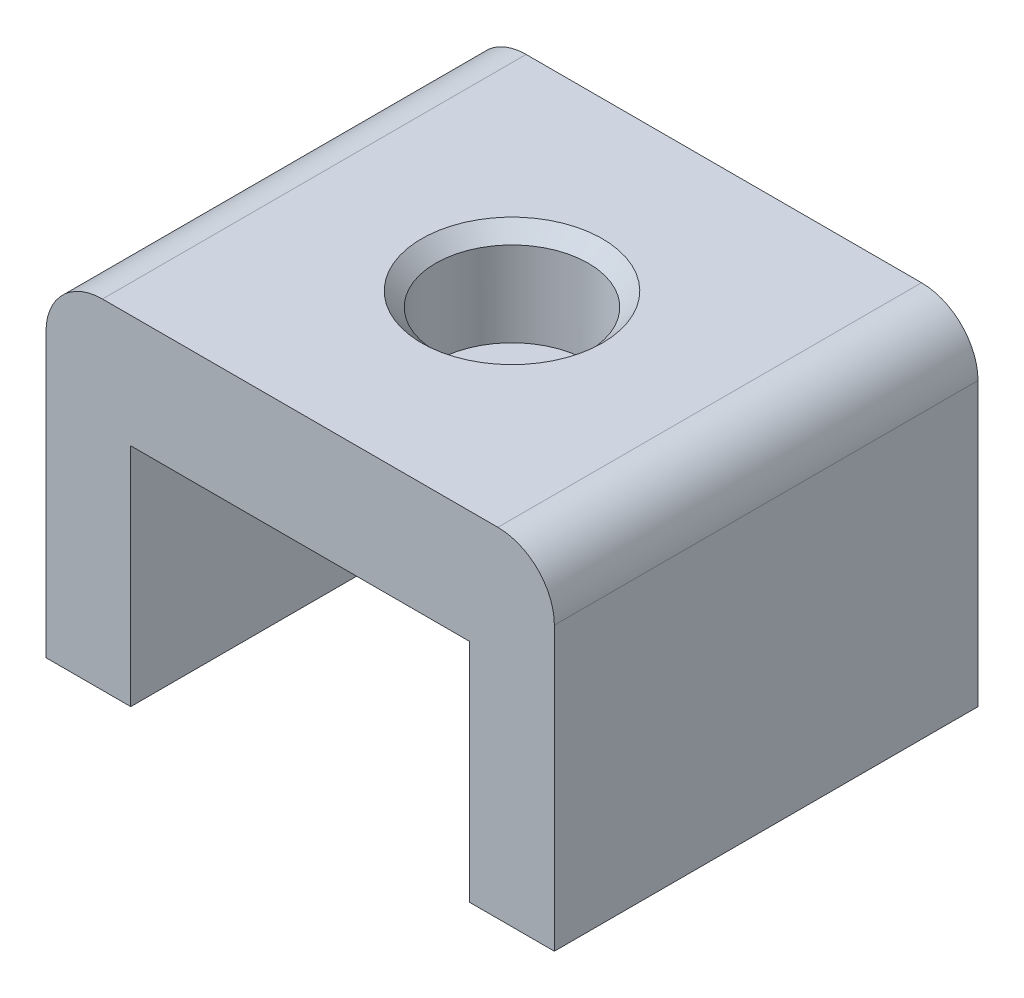
from build123d import *

# Parameters (mm, degrees)
EXTRUDE_1_DEPTH     = 15
SKETCH_2_R          = 2.7
CUT_EXTRUDE_1_DEPTH = 3.5
SKETCH_3_R          = 1.65
CUT_EXTRUDE_2_DEPTH = 25.924887161
FILLET_1_R          = 2
CHAMFER_1_SIZE      = 0.5


# Read off the part's stored shape, not the designer's step: 填料-伸長1
with BuildPart() as part:
    # 填料-伸長1 outline → 填料-伸長1 (new body)
    with BuildSketch(Plane.XY):
        Polygon((0, 0), (0, 12), (-18, 12), (-18, 0), (-15, 0), (-15, 8), (-3, 8), (-3, 0), align=None)
    extrude(amount=EXTRUDE_1_DEPTH)

    # 草圖2 → 除料-伸長1 (cut)
    with BuildSketch(Plane(origin=(0, 12, 0), x_dir=(1, 0, 0), z_dir=(0, 1, 0))):
        with Locations(Location((-9, -7.5, 0), (0, 0, 180))):
            Circle(SKETCH_2_R)
    extrude(amount=-CUT_EXTRUDE_1_DEPTH, mode=Mode.SUBTRACT)

    # 草圖3 → 除料-伸長2 (cut, through all)
    with BuildSketch(Plane(origin=(0, 8.5, 0), x_dir=(1, 0, 0), z_dir=(0, 1, 0))):
        with Locations(Location((-9, -7.5, 0), (0, 0, 180))):
            Circle(SKETCH_3_R)
    extrude(amount=-CUT_EXTRUDE_2_DEPTH, mode=Mode.SUBTRACT)

    # 圓角1
    fillet_1_edges = [part.edges().sort_by_distance(p)[0] for p in [
        (-18, 12, 7.5),
        (0, 12, 7.5),
    ]]
    fillet(fillet_1_edges, radius=FILLET_1_R)

    # 導角1
    chamfer_1_edges = [part.edges().sort_by_distance(p)[0] for p in [
        (-6.3, 12, 7.5),
    ]]
    chamfer(chamfer_1_edges, length=CHAMFER_1_SIZE)


solid = part.part
